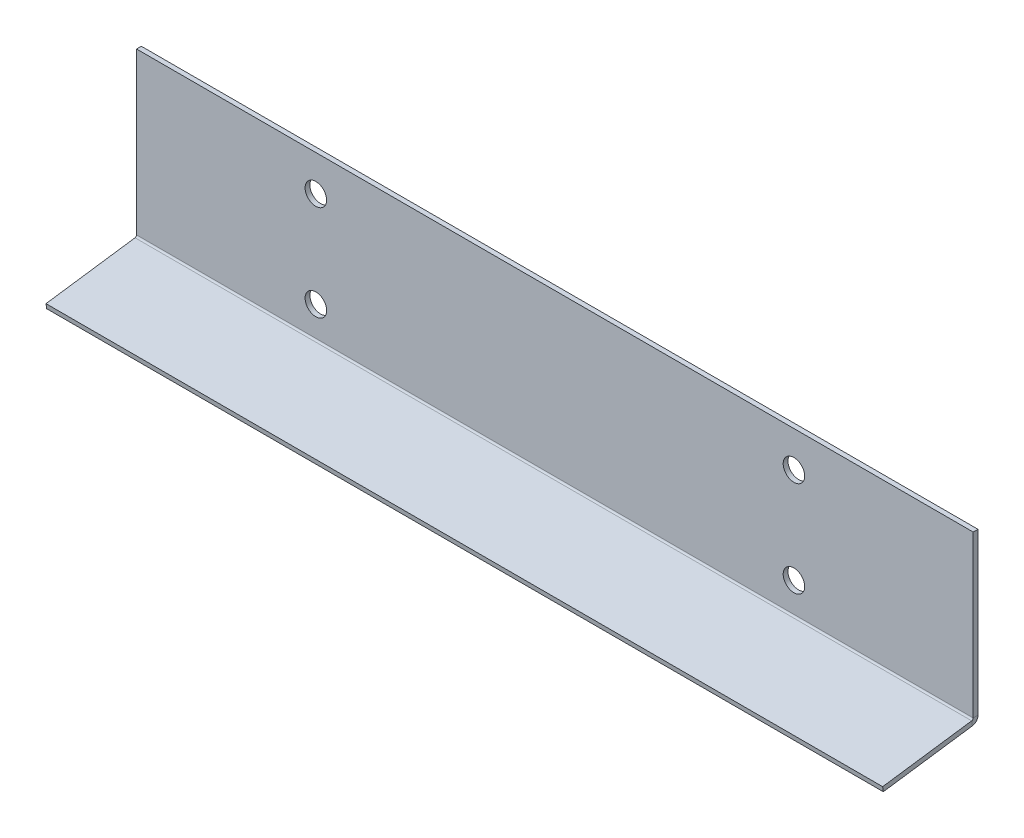
from build123d import *

# Parameters (mm, degrees)
SKETCH1_W            = 350
SKETCH1_H            = 70
BASE_FLANGE1_DEPTH   = 2
EDGE_FLANGE1_START   = -175
EDGE_FLANGE1_DEPTH   = 350
EDGE_FLANGE1_2_DEPTH = 350
M8_CLEARANCE_HOLE1_D = 9


# Read off the part's stored shape, not the designer's step: Edge-Flange1
# Sheet-metal steps are written as plain solids
with BuildPart() as part:
    # Sketch1 → Base-Flange1 (new body)
    with BuildSketch(Plane.XY):
        Rectangle(SKETCH1_W, SKETCH1_H)
    extrude(amount=-BASE_FLANGE1_DEPTH)

    # Edge-Flange1 outline → Edge-Flange1 (cut)
    with BuildSketch(Plane.YZ.offset(EDGE_FLANGE1_START)):
        with BuildLine():
            ThreePointArc((-32.340028244, -2), (-33.994295453, -1.443395312), (-34.975630642, 0))
            Line((-34.975630642, 0), (-35, 0))
            Line((-35, 0), (-35, -2))
            Line((-35, -2), (-32.340028244, -2))
        make_face()
    extrude(amount=EDGE_FLANGE1_DEPTH, mode=Mode.SUBTRACT)

    # Edge-Flange1 2 outline → Edge-Flange1 2 (add)
    with BuildSketch(Plane.YZ.offset(EDGE_FLANGE1_START)):
        with BuildLine():
            Line((-40.285842369, 37.61072275), (-35.049995841, 0.355738892))
            ThreePointArc((-35.049995841, 0.355738892), (-35.018725163, 0.176633592), (-34.975630642, 0))
            Line((-34.975630642, 0), (-32.340028244, 0))
            ThreePointArc((-32.340028244, 0), (-32.823281325, 0.180680923), (-33.069459703, 0.634085094))
            Line((-33.069459703, 0.634085094), (-38.305306232, 37.889068952))
            Line((-38.305306232, 37.889068952), (-40.285842369, 37.61072275))
        make_face()
    extrude(amount=EDGE_FLANGE1_2_DEPTH)

    # M8 Clearance Hole1 (through all)
    with Locations(Plane(origin=(-100, 20, 0), x_dir=(1, 0, 0), z_dir=(0, 0, 1))):
        with Locations((0, 0), (0, -40), (200, -40), (200, 0)):
            Hole(M8_CLEARANCE_HOLE1_D / 2)


solid = part.part
